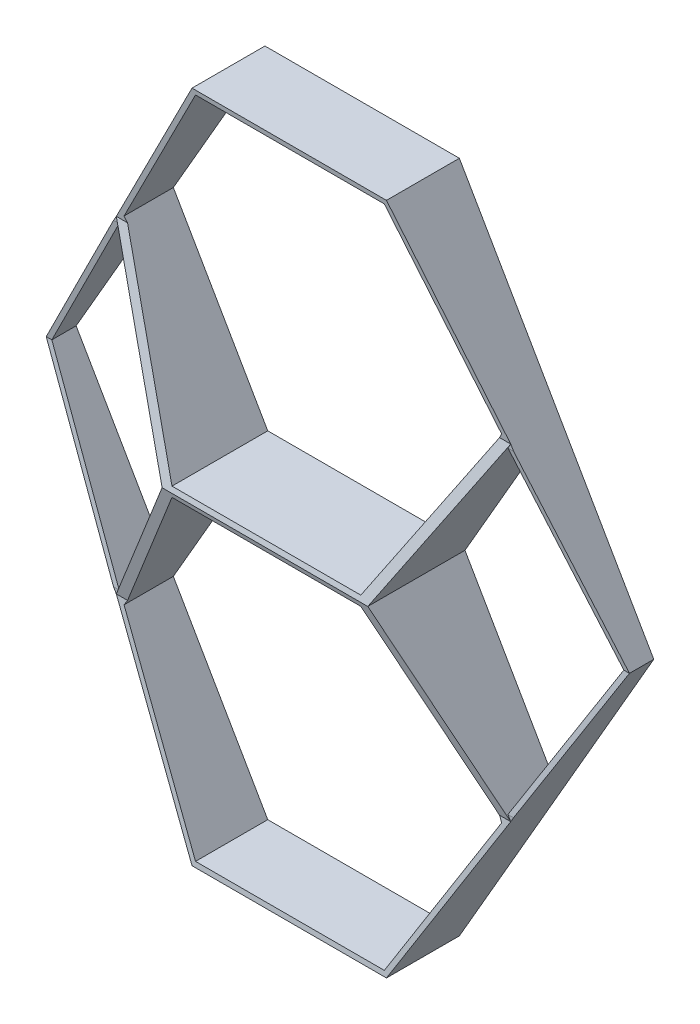
from build123d import *

# Parameters (mm, degrees)
EXTRUDE_1_DEPTH     = 100
EXTRUDE_2_DEPTH     = 100
EXTRUDE_3_DEPTH     = 100
EXTRUDE_START       = -100
EXTRUDE_4_DEPTH     = 100
CUT_EXTRUDE_1_DEPTH = 1221.655561574
EXTRUDE_1_2_DEPTH   = 100
CUT_EXTRUDE_2_DEPTH = 1226.38987213


# Read off the part's stored shape, not the designer's step: 拉伸-薄壁4
with BuildPart() as part:
    # 草图1 → Extrude 1 (new body)
    with BuildSketch(Plane.XY):
        Polygon((-600, 0), (-400, 346.410161514), (-200, 0), (-400, -346.410161514), align=None)
        Polygon((-588.452994616, 0), (-400, 326.410161514), (-211.547005384, 0), (-400, -326.410161514), align=None, mode=Mode.SUBTRACT)
    extrude(amount=-EXTRUDE_1_DEPTH)

    # 草图1<4> → 拉伸-薄壁2 (add)
    with BuildSketch(Plane.XY):
        Polygon((400, -346.410161514), (200, -692.820323028), (-200, -692.820323028), (-400, -346.410161514), (-200, 0), (0, 0), (200, 0), align=None)
        Polygon((388.452994616, -346.410161514), (194.226497308, -682.820323028), (-194.226497308, -682.820323028), (-388.452994616, -346.410161514), (-194.226497308, -10), (0, -10), (194.226497308, -10), align=None, mode=Mode.SUBTRACT)
    extrude(amount=-EXTRUDE_2_DEPTH)

    # 草图1<5> → 拉伸-薄壁3 (add)
    with BuildSketch(Plane.XY):
        Polygon((400, -346.410161514), (200, 0), (400, 346.410161514), (600, 0), align=None)
        Polygon((400, -326.410161514), (211.547005384, 0), (400, 326.410161514), (588.452994616, 0), align=None, mode=Mode.SUBTRACT)
    extrude(amount=-EXTRUDE_3_DEPTH)

    # 拉伸-薄壁4 outline → 拉伸-薄壁4 (add)
    with BuildSketch(Plane.XY.offset(EXTRUDE_START)):
        Polygon((200, 692.820323028), (-200, 692.820323028), (-400, 346.410161514), (-200, 0), (200, 0), (400, 346.410161514), align=None)
        Polygon((-194.226497308, 10), (-388.452994616, 346.410161514), (-194.226497308, 682.820323028), (194.226497308, 682.820323028), (388.452994616, 346.410161514), (194.226497308, 10), align=None, mode=Mode.SUBTRACT)
    extrude(amount=EXTRUDE_4_DEPTH)

    # 草图4 → 切除-拉伸1 (cut, through all)
    with BuildSketch(Plane(origin=(-400, 0, 0), x_dir=(0, 0, -1), z_dir=(1, 0, 0))):
        Polygon((50, 0), (0, -326.410161514), (0, 0), (0, 326.410161514), align=None)
    cut_extrude_1 = extrude(amount=-CUT_EXTRUDE_1_DEPTH, mode=Mode.SUBTRACT)

    # 镜向1: 切除-拉伸1 across plane
    add(cut_extrude_1.mirror(Plane(origin=(0, 0, 0), x_dir=(0, 0, 1), z_dir=(1, 0, 0))), mode=Mode.SUBTRACT)

    # 草图2 → Extrude 1 2 (add)
    with BuildSketch(Plane.XY):
        Polygon((388.452994616, 346.410161514), (400, 326.410161514), (405.773502692, 336.410161514), (200, 692.820323028), (-200, 692.820323028), (-405.773502692, 336.410161514), (-400, 326.410161514), (-388.452994616, 346.410161514), (-194.226497308, 682.820323028), (194.226497308, 682.820323028), align=None)
        Polygon((-400, -326.410161514), (-388.452994616, -346.410161514), (-194.226497308, -10), (194.226497308, -10), (388.452994616, -346.410161514), (400, -326.410161514), (211.547005384, 0), (400, 326.410161514), (388.452994616, 346.410161514), (194.226497308, 10), (-194.226497308, 10), (-388.452994616, 346.410161514), (-400, 326.410161514), (-211.547005384, 0), align=None)
        Polygon((405.773502692, -336.410161514), (400, -326.410161514), (388.452994616, -346.410161514), (194.226497308, -682.820323028), (-194.226497308, -682.820323028), (-388.452994616, -346.410161514), (-400, -326.410161514), (-405.773502692, -336.410161514), (-200, -692.820323028), (200, -692.820323028), align=None)
    extrude(amount=EXTRUDE_1_2_DEPTH)

    # 草图6 → 切除-拉伸2 (cut, through all)
    with BuildSketch(Plane.ZY.offset(405.773502692)):
        Polygon((100, 692.820323028), (100, 336.410161514), (0, 336.410161514), align=None)
        Polygon((100, 0), (0, 336.410161514), (100, 336.410161514), align=None)
        Polygon((100, 0), (100, -336.410161514), (0, -336.410161514), align=None)
        Polygon((100, -692.820323028), (0, -336.410161514), (100, -336.410161514), align=None)
        Polygon((50, -692.820323028), (100, -692.820323028), (50, -514.615242271), align=None)
        Polygon((50, -514.615242271), (0, -336.410161514), (50, -692.820323028), align=None)
        Polygon((50, -514.615242271), (50, -336.410161514), (0, -336.410161514), align=None)
        Polygon((50, 514.615242271), (0, 336.410161514), (50, 336.410161514), align=None)
        Polygon((50, 692.820323028), (0, 336.410161514), (50, 514.615242271), align=None)
        Polygon((50, 514.615242271), (100, 692.820323028), (50, 692.820323028), align=None)
    extrude(amount=-CUT_EXTRUDE_2_DEPTH, mode=Mode.SUBTRACT)


solid = part.part
